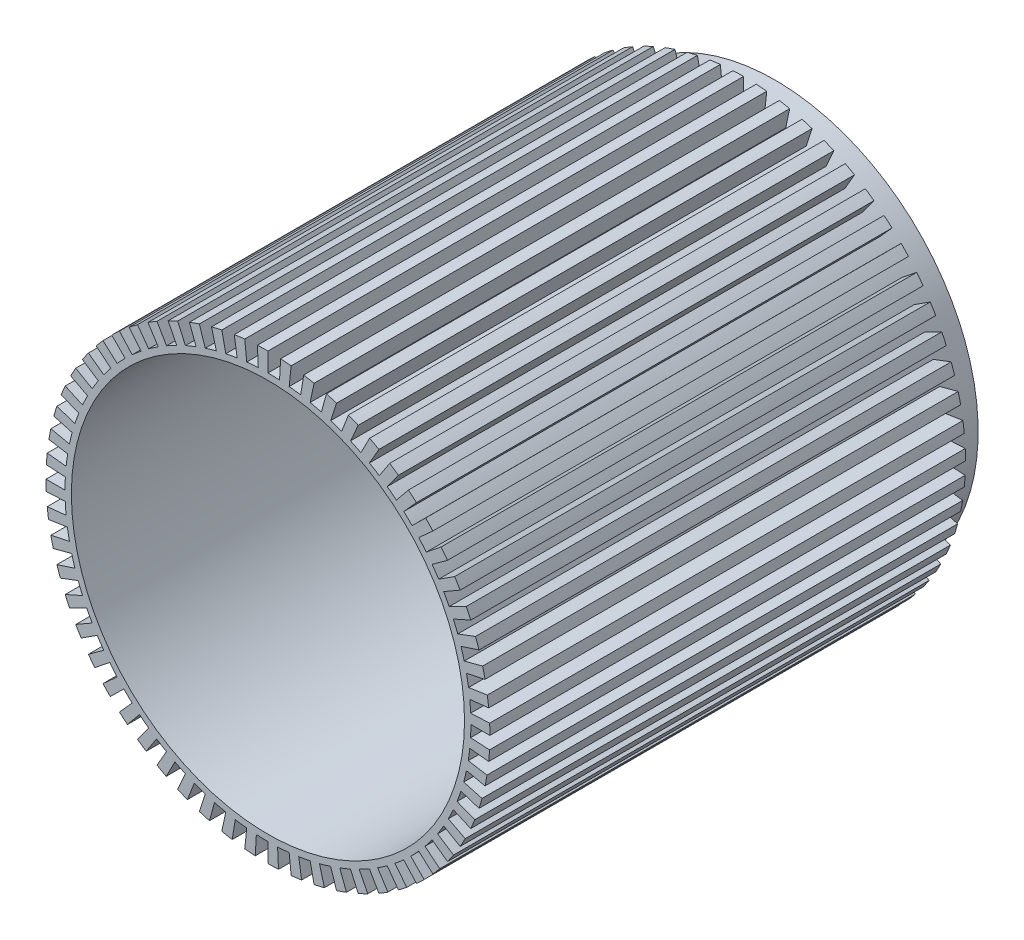
from build123d import *
from build123d.topology import SkipClean

# Parameters (mm, degrees)
SKETCH1_R           = 35
BOSS_EXTRUDE1_DEPTH = 80
CIRPATTERN1_COUNT   = 60
SKETCH4_R           = 35
SKETCH4_R_2         = 31.999999999999986
CUT_EXTRUDE1_DEPTH  = 5
SHELL1_START        = 1
SHELL1_OUTLINE_R    = 31
SHELL1_DEPTH        = 79


# Read off the part's stored shape, not the designer's step: Shell1
with BuildPart() as part:
    # Sketch1 → Boss-Extrude1 (new body)
    with BuildSketch(Plane.XY):
        Circle(SKETCH1_R)
    extrude(amount=BOSS_EXTRUDE1_DEPTH)

    # Cut-Sweep1: sweep along a path in Sketch3
    with BuildLine(Plane.XY) as cut_sweep1_path:
        ThreePointArc((-34.99999999999999, 0), (-34.985699683413, 1.0004087474801484), (-34.94281041931229, 2))
    # Sketch2 → Cut-Sweep1 (sweep, cut)
    with BuildSketch(Plane(origin=(0, 0, 0), x_dir=(1, 0, 0), z_dir=(0, 1, 0))):
        Polygon((-34.99999999999999, 0), (-31.999999999999993, 0), (-31.999999999999986, -80), (-34.99999999999999, -80), align=None)
    cut_sweep1 = sweep(path=cut_sweep1_path.line, mode=Mode.SUBTRACT)

    # CirPattern1: Cut-Sweep1 ×60 about axis
    cirpattern1_axis = Axis((0, 0, 0), (0, 0, 1))
    for i in range(1, CIRPATTERN1_COUNT):
        add(cut_sweep1.rotate(cirpattern1_axis, i * 360 / CIRPATTERN1_COUNT), mode=Mode.SUBTRACT)

    # Sketch4 → Cut-Extrude1 (cut)
    with SkipClean():  # the faces are left unmerged after this step: merging them gives an invalid solid
        with BuildSketch(Plane.XY):
            Circle(SKETCH4_R)
            with Locations(Location((0, 0, 0), (0, 0, 180))):
                Circle(SKETCH4_R_2, mode=Mode.SUBTRACT)
        extrude(amount=CUT_EXTRUDE1_DEPTH, mode=Mode.SUBTRACT)

    # Shell1 outline → Shell1 (cut)
    with SkipClean():  # the faces are left unmerged after this step: merging them gives an invalid solid
        with BuildSketch(Plane.XY.offset(SHELL1_START)):
            Circle(SHELL1_OUTLINE_R)
        extrude(amount=SHELL1_DEPTH, mode=Mode.SUBTRACT)


solid = part.part
